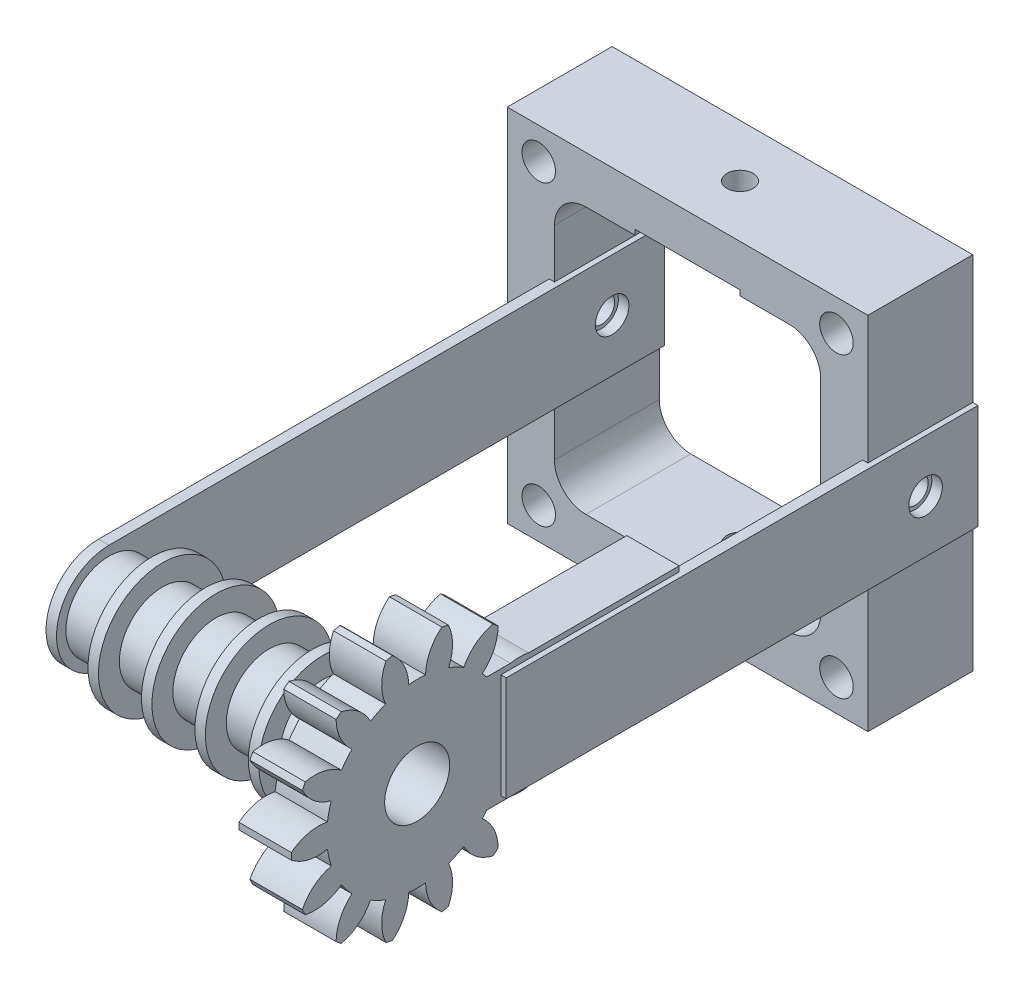
from build123d import *
from build123d.topology import SkipClean

# Parameters (mm, degrees)
BASPROSKE_W              = 5
BASPROSKE_H              = 12
TOOTHCUT_DEPTH           = 18.691806013
TEETHCUTS_COUNT          = 14
TEETHCUTS_ANGLE          = 334.285714286
BORSKE_R                 = 3.1
BORE_DEPTH               = 50.0000508
SKETCH_2_W               = 20
SKETCH_2_H               = 11
EXTRUDE_1_DEPTH          = 5
SKETCH_3_W               = 17
SKETCH_3_H               = 10
CUT_EXTRUDE_1_DEPTH      = 0.5
SKETCH_5_W               = 10
SKETCH_5_H               = 10
SKETCH_5_W_2             = 8
SKETCH_5_H_2             = 8
EXTRUDE_2_DEPTH          = 40
SKETCH_12_W              = 9
SKETCH_12_H              = 10
CUT_EXTRUDE_4_DEPTH      = 63.83857643
CUT_EXTRUDE_2_DEPTH      = 50.726116758
CUT_EXTRUDE_2_DEPTH_BACK = 50.726116758
SKETCH_4_R               = 1.25
SKETCH_7_R               = 4.1
SKETCH_7_R_2             = 3.1
EXTRUDE_3_DEPTH          = 4
PATTERN_LINEAR_1_COUNT   = 5
PATTERN_LINEAR_1_PITCH   = 5.1
SKETCH_14_R              = 3.1
EXTRUDE_5_DEPTH          = 1
SKETCH_15_W              = 34.4
SKETCH_15_H              = 34.4
SKETCH_15_R              = 1.6
EXTRUDE_6_DEPTH          = 5
SKETCH_17_R              = 6.1
SKETCH_17_R_2            = 3.1
EXTRUDE_8_DEPTH          = 1
PATTERN_LINEAR_3_COUNT   = 4
PATTERN_LINEAR_3_PITCH   = 5.1
PATTERN_LINEAR_2_COUNT   = 2
PATTERN_LINEAR_2_PITCH   = 100
MOVE_BODY_2_ANGLE        = 180
MOVE_BODY_2_2_ANGLE      = 180
MOVE_BODY_2_3_ANGLE      = 180
MOVE_BODY_2_4_ANGLE      = 180
MOVE_BODY_2_5_ANGLE      = 180
MOVE_BODY_2_6_ANGLE      = 180
MOVE_BODY_2_7_ANGLE      = 180
MOVE_BODY_2_8_ANGLE      = 180
MOVE_BODY_2_9_ANGLE      = 180
MOVE_BODY_2_10_ANGLE     = 180
MOVE_BODY_2_11_ANGLE     = 180
MOVE_BODY_2_12_ANGLE     = 180
MOVE_BODY_2_13_ANGLE     = 180
CUT_EXTRUDE_5_DEPTH      = 70.120546873
CUT_EXTRUDE_5_DEPTH_BACK = 70.120546873
SKETCH_16_W              = 10
SKETCH_16_H              = 1
SKETCH_16_W_2            = 1
SKETCH_16_H_2            = 10
EXTRUDE_START            = -5
EXTRUDE_7_OUTLINE_W      = 1
EXTRUDE_7_OUTLINE_H      = 10
EXTRUDE_7_DEPTH          = 5
EXTRUDE_7_2_OUTLINE_W    = 1
EXTRUDE_7_2_OUTLINE_H    = 10
EXTRUDE_7_2_DEPTH        = 5
EXTRUDE_7_3_OUTLINE_W    = 10
EXTRUDE_7_3_OUTLINE_H    = 1
EXTRUDE_7_3_DEPTH        = 5
EXTRUDE_7_4_OUTLINE_W    = 10
EXTRUDE_7_4_OUTLINE_H    = 1
EXTRUDE_7_4_DEPTH        = 5
SKETCH_21_R              = 1.25
CUT_EXTRUDE_6_DEPTH      = 115.870796985
SKETCH_22_R              = 1.25
CUT_EXTRUDE_7_DEPTH      = 118.244914602
SKETCH_23_R              = 1.6
CUT_EXTRUDE_8_DEPTH      = 115.870796985
SKETCH_24_R              = 1.6
CUT_EXTRUDE_9_DEPTH      = 118.244914602


with BuildPart() as part:
    # BasProSke → Base-Revolve (revolve)
    with BuildSketch(Plane(origin=(0, 0, 0), x_dir=(1, 0, 0), z_dir=(0, 1, 0)), mode=Mode.PRIVATE) as base_revolve_sk:
        with Locations((2.5, 6)):
            Rectangle(BASPROSKE_W, BASPROSKE_H)
    revolve(base_revolve_sk.sketch.rotate(Axis((-10, 0, 0), (1, 0, 0)), 180), axis=Axis((-10, 0, 0), (1, 0, 0)))

    # TooCutSke → ToothCut (cut, through all)
    with BuildSketch(Plane(origin=(0, 0, 0), x_dir=(0, 0, -1), z_dir=(1, 0, 0))):
        with BuildLine():
            ThreePointArc((0.804845511, 8.586361261), (0, 8.624), (-0.804845511, 8.586361261))
            ThreePointArc((-0.804845511, 8.586361261), (-1.237812142, 10.362618414), (-2.384428228, 11.78663426))
            ThreePointArc((-2.384428228, 11.78663426), (0, 12.0254), (2.384428228, 11.78663426))
            ThreePointArc((2.384428228, 11.78663426), (1.237812142, 10.362618414), (0.804845511, 8.586361261))
        make_face()
    toothcut = extrude(amount=TOOTHCUT_DEPTH, mode=Mode.SUBTRACT)

    # TeethCuts: ToothCut ×14 about axis
    teethcuts_axis = Axis((-10, 0, 0), (1, 0, 0))
    for i in range(1, TEETHCUTS_COUNT):
        add(toothcut.rotate(teethcuts_axis, i * TEETHCUTS_ANGLE / (TEETHCUTS_COUNT - 1)), mode=Mode.SUBTRACT)

    # BorSke → Bore (cut, symmetric)
    with BuildSketch(Plane(origin=(0, 0, 0), x_dir=(0, 0, -1), z_dir=(1, 0, 0))):
        with Locations(Location((0, 0, 0), (0, 0, 180))):
            Circle(BORSKE_R)
    extrude(amount=BORE_DEPTH, both=True, mode=Mode.SUBTRACT)

    # ｽｹｯﾁ2 → ﾎﾞｽ - 押し出し1 (add)
    with BuildSketch(Plane(origin=(5, 0, 0), x_dir=(0, 0, -1), z_dir=(1, 0, 0))):
        with Locations((15, 0)):
            Rectangle(SKETCH_2_W, SKETCH_2_H)
    extrude(amount=-EXTRUDE_1_DEPTH)

    # ｽｹｯﾁ3 → ｶｯﾄ - 押し出し1 (cut)
    with BuildSketch(Plane(origin=(5, 0, 0), x_dir=(0, 0, -1), z_dir=(1, 0, 0))):
        with Locations((16.5, 0)):
            Rectangle(SKETCH_3_W, SKETCH_3_H)
    extrude(amount=-CUT_EXTRUDE_1_DEPTH, mode=Mode.SUBTRACT)

    # ｽｹｯﾁ4 → ｶｯﾄ - 押し出し2 (cut, two sides: drawn at the far end of the back side and taken through both)
    with BuildSketch(Plane.ZY.offset(-CUT_EXTRUDE_2_DEPTH_BACK)):
        with Locations(Location((-21, 0, 0), (0, 0, 180))):
            Circle(SKETCH_4_R)
        with Locations(Location((-13, 0, 0), (0, 0, 180))):
            Circle(SKETCH_4_R)
    extrude(amount=CUT_EXTRUDE_2_DEPTH + CUT_EXTRUDE_2_DEPTH_BACK, mode=Mode.SUBTRACT)


with BuildPart() as body_2:
    # ｽｹｯﾁ5 → ﾎﾞｽ - 押し出し2 (new body)
    with BuildSketch(Plane(origin=(0, 0, -8), x_dir=(-1, 0, 0), z_dir=(0, 0, -1))):
        with Locations((-9.5, 0)):
            Rectangle(SKETCH_5_W, SKETCH_5_H)
        with Locations((-9.5, 0)):
            Rectangle(SKETCH_5_W_2, SKETCH_5_H_2, mode=Mode.SUBTRACT)
    extrude(amount=EXTRUDE_2_DEPTH)

    # ｽｹｯﾁ12 → ｶｯﾄ - 押し出し4 (cut, through all)
    with BuildSketch(Plane(origin=(0, 0, -48), x_dir=(-1, 0, 0), z_dir=(0, 0, -1))):
        with Locations((-10, 0)):
            Rectangle(SKETCH_12_W, SKETCH_12_H)
    extrude(amount=-CUT_EXTRUDE_4_DEPTH, mode=Mode.SUBTRACT)


with BuildPart() as body_3:
    # ｽｹｯﾁ7 → ﾎﾞｽ - 押し出し3 (new body)
    with BuildSketch(Plane.ZY):
        Circle(SKETCH_7_R)
        Circle(SKETCH_7_R_2, mode=Mode.SUBTRACT)
    extrude(amount=EXTRUDE_3_DEPTH)


with BuildPart() as pattern_linear_1_1:
    # 直線ﾊﾟﾀｰﾝ1: pattern copy
    add(body_3.part.moved(Location(Vector(-1, 0, 0) * (1 * PATTERN_LINEAR_1_PITCH))))


with BuildPart() as pattern_linear_1_2:
    # 直線ﾊﾟﾀｰﾝ1: pattern copy
    add(body_3.part.moved(Location(Vector(-1, 0, 0) * (2 * PATTERN_LINEAR_1_PITCH))))


with BuildPart() as pattern_linear_1_3:
    # 直線ﾊﾟﾀｰﾝ1: pattern copy
    add(body_3.part.moved(Location(Vector(-1, 0, 0) * (3 * PATTERN_LINEAR_1_PITCH))))


with BuildPart() as pattern_linear_1_4:
    # 直線ﾊﾟﾀｰﾝ1: pattern copy
    add(body_3.part.moved(Location(Vector(-1, 0, 0) * (4 * PATTERN_LINEAR_1_PITCH))))


with BuildPart() as body_8:
    # ｽｹｯﾁ14 → ﾎﾞｽ - 押し出し5 (new body)
    with BuildSketch(Plane.ZY.offset(24.4)):
        with BuildLine():
            Line((-48, 5), (0, 5))
            ThreePointArc((0, 5), (5, 0), (0, -5))
            Line((0, -5), (-48, -5))
            Line((-48, -5), (-48, 5))
        make_face()
        Circle(SKETCH_14_R, mode=Mode.SUBTRACT)
    extrude(amount=EXTRUDE_5_DEPTH)


with BuildPart() as body_9:
    # ｽｹｯﾁ15 → ﾎﾞｽ - 押し出し6 (new body)
    with BuildSketch(Plane(origin=(0, 0, -48), x_dir=(-1, 0, 0), z_dir=(0, 0, -1))):
        with Locations((12.2, 0)):
            Rectangle(SKETCH_15_W, SKETCH_15_H)
        with Locations(Location((26.4, 14.2, 0), (0, 0, 90))):
            Circle(SKETCH_15_R, mode=Mode.SUBTRACT)
        with Locations(Location((26.4, -14.2, 0), (0, 0, 90))):
            Circle(SKETCH_15_R, mode=Mode.SUBTRACT)
        with Locations(Location((-2, -14.2, 0), (0, 0, 90))):
            Circle(SKETCH_15_R, mode=Mode.SUBTRACT)
        with Locations(Location((-2, 14.2, 0), (0, 0, 90))):
            Circle(SKETCH_15_R, mode=Mode.SUBTRACT)
        with BuildLine():
            Line((21.9, -12.7), (2.5, -12.7))
            ThreePointArc((2.5, -12.7), (0.378679656, -11.821320344), (-0.5, -9.7))
            Line((-0.5, -9.7), (-0.5, 9.7))
            ThreePointArc((-0.5, 9.7), (0.378679656, 11.821320344), (2.5, 12.7))
            Line((2.5, 12.7), (21.9, 12.7))
            ThreePointArc((21.9, 12.7), (24.021320344, 11.821320344), (24.9, 9.7))
            Line((24.9, 9.7), (24.9, -9.7))
            ThreePointArc((24.9, -9.7), (24.021320344, -11.821320344), (21.9, -12.7))
        make_face(mode=Mode.SUBTRACT)
    extrude(amount=-EXTRUDE_6_DEPTH)


with BuildPart() as body_10:
    # ｽｹｯﾁ17 → ﾎﾞｽ - 押し出し8 (new body)
    with BuildSketch(Plane.ZY.offset(4)):
        Circle(SKETCH_17_R)
        Circle(SKETCH_17_R_2, mode=Mode.SUBTRACT)
    extrude(amount=EXTRUDE_8_DEPTH)


with BuildPart() as pattern_linear_3_1:
    # 直線ﾊﾟﾀｰﾝ3: pattern copy
    add(body_10.part.moved(Location(Vector(-1, 0, 0) * (1 * PATTERN_LINEAR_3_PITCH))))


with BuildPart() as pattern_linear_3_2:
    # 直線ﾊﾟﾀｰﾝ3: pattern copy
    add(body_10.part.moved(Location(Vector(-1, 0, 0) * (2 * PATTERN_LINEAR_3_PITCH))))


with BuildPart() as pattern_linear_3_3:
    # 直線ﾊﾟﾀｰﾝ3: pattern copy
    add(body_10.part.moved(Location(Vector(-1, 0, 0) * (3 * PATTERN_LINEAR_3_PITCH))))


with BuildPart() as pattern_linear_2_1:
    # 直線ﾊﾟﾀｰﾝ2: pattern copy
    add(body_10.part.moved(Location(Vector(0, 0, -1) * (1 * PATTERN_LINEAR_2_PITCH))))


with BuildPart() as pattern_linear_2_2:
    # 直線ﾊﾟﾀｰﾝ2: pattern copy
    add(pattern_linear_3_1.part.moved(Location(Vector(0, 0, -1) * (1 * PATTERN_LINEAR_2_PITCH))))


with BuildPart() as pattern_linear_2_3:
    # 直線ﾊﾟﾀｰﾝ2: pattern copy
    add(pattern_linear_3_2.part.moved(Location(Vector(0, 0, -1) * (1 * PATTERN_LINEAR_2_PITCH))))


with BuildPart() as pattern_linear_2_4:
    # 直線ﾊﾟﾀｰﾝ2: pattern copy
    add(pattern_linear_3_3.part.moved(Location(Vector(0, 0, -1) * (1 * PATTERN_LINEAR_2_PITCH))))


with BuildPart() as pattern_linear_2_5:
    # 直線ﾊﾟﾀｰﾝ2: pattern copy
    add(body_3.part.moved(Location(Vector(0, 0, -1) * (1 * PATTERN_LINEAR_2_PITCH))))


with BuildPart() as pattern_linear_2_6:
    # 直線ﾊﾟﾀｰﾝ2: pattern copy
    add(pattern_linear_1_1.part.moved(Location(Vector(0, 0, -1) * (1 * PATTERN_LINEAR_2_PITCH))))


with BuildPart() as pattern_linear_2_7:
    # 直線ﾊﾟﾀｰﾝ2: pattern copy
    add(body_9.part.moved(Location(Vector(0, 0, -1) * (1 * PATTERN_LINEAR_2_PITCH))))


with BuildPart() as pattern_linear_2_8:
    # 直線ﾊﾟﾀｰﾝ2: pattern copy
    add(pattern_linear_1_2.part.moved(Location(Vector(0, 0, -1) * (1 * PATTERN_LINEAR_2_PITCH))))


with BuildPart() as pattern_linear_2_9:
    # 直線ﾊﾟﾀｰﾝ2: pattern copy
    add(pattern_linear_1_3.part.moved(Location(Vector(0, 0, -1) * (1 * PATTERN_LINEAR_2_PITCH))))


with BuildPart() as pattern_linear_2_10:
    # 直線ﾊﾟﾀｰﾝ2: pattern copy
    add(body_2.part.moved(Location(Vector(0, 0, -1) * (1 * PATTERN_LINEAR_2_PITCH))))


with BuildPart() as pattern_linear_2_11:
    # 直線ﾊﾟﾀｰﾝ2: pattern copy
    add(part.part.moved(Location(Vector(0, 0, -1) * (1 * PATTERN_LINEAR_2_PITCH))))


with BuildPart() as pattern_linear_2_12:
    # 直線ﾊﾟﾀｰﾝ2: pattern copy
    add(pattern_linear_1_4.part.moved(Location(Vector(0, 0, -1) * (1 * PATTERN_LINEAR_2_PITCH))))


with BuildPart() as pattern_linear_2_13:
    # 直線ﾊﾟﾀｰﾝ2: pattern copy
    add(body_8.part.moved(Location(Vector(0, 0, -1) * (1 * PATTERN_LINEAR_2_PITCH))))


with BuildPart() as pattern_linear_2_2_1:
    # Move Body 2: read off the stored shape, not the designer's step
    # Move Body 2: moved
    add(pattern_linear_2_2.part.moved(Location((12.2, 12.2, 196))).rotate(Axis((0, 0, 0), (0.7071067812, -0.7071067812, 0)), MOVE_BODY_2_ANGLE))


with BuildPart() as pattern_linear_2_12_1:
    # Move Body 2 2: moved
    add(pattern_linear_2_12.part.moved(Location((12.2, 12.2, 196))).rotate(Axis((0, 0, 0), (0.7071067812, -0.7071067812, 0)), MOVE_BODY_2_2_ANGLE))


with BuildPart() as pattern_linear_2_9_1:
    # Move Body 2 3: moved
    add(pattern_linear_2_9.part.moved(Location((12.2, 12.2, 196))).rotate(Axis((0, 0, 0), (0.7071067812, -0.7071067812, 0)), MOVE_BODY_2_3_ANGLE))


with BuildPart() as pattern_linear_2_11_1:
    # Move Body 2 4: moved
    add(pattern_linear_2_11.part.moved(Location((12.2, 12.2, 196))).rotate(Axis((0, 0, 0), (0.7071067812, -0.7071067812, 0)), MOVE_BODY_2_4_ANGLE))


with BuildPart() as pattern_linear_2_3_1:
    # Move Body 2 5: moved
    add(pattern_linear_2_3.part.moved(Location((12.2, 12.2, 196))).rotate(Axis((0, 0, 0), (0.7071067812, -0.7071067812, 0)), MOVE_BODY_2_5_ANGLE))


with BuildPart() as pattern_linear_2_4_1:
    # Move Body 2 6: moved
    add(pattern_linear_2_4.part.moved(Location((12.2, 12.2, 196))).rotate(Axis((0, 0, 0), (0.7071067812, -0.7071067812, 0)), MOVE_BODY_2_6_ANGLE))


with BuildPart() as pattern_linear_2_5_1:
    # Move Body 2 7: moved
    add(pattern_linear_2_5.part.moved(Location((12.2, 12.2, 196))).rotate(Axis((0, 0, 0), (0.7071067812, -0.7071067812, 0)), MOVE_BODY_2_7_ANGLE))


with BuildPart() as pattern_linear_2_8_1:
    # Move Body 2 8: moved
    add(pattern_linear_2_8.part.moved(Location((12.2, 12.2, 196))).rotate(Axis((0, 0, 0), (0.7071067812, -0.7071067812, 0)), MOVE_BODY_2_8_ANGLE))


with BuildPart() as pattern_linear_2_6_1:
    # Move Body 2 9: moved
    add(pattern_linear_2_6.part.moved(Location((12.2, 12.2, 196))).rotate(Axis((0, 0, 0), (0.7071067812, -0.7071067812, 0)), MOVE_BODY_2_9_ANGLE))


with BuildPart() as pattern_linear_2_1_1:
    # Move Body 2 10: moved
    add(pattern_linear_2_1.part.moved(Location((12.2, 12.2, 196))).rotate(Axis((0, 0, 0), (0.7071067812, -0.7071067812, 0)), MOVE_BODY_2_10_ANGLE))


with BuildPart() as pattern_linear_2_13_1:
    # Move Body 2 11: moved
    add(pattern_linear_2_13.part.moved(Location((12.2, 12.2, 196))).rotate(Axis((0, 0, 0), (0.7071067812, -0.7071067812, 0)), MOVE_BODY_2_11_ANGLE))

    # Extrude 7 3 outline → Extrude 7 3 (add)
    with BuildSketch(Plane.XY.offset(-48)):
        with Locations((-12.2, 12.7)):
            Rectangle(EXTRUDE_7_3_OUTLINE_W, EXTRUDE_7_3_OUTLINE_H)
    extrude(amount=EXTRUDE_7_3_DEPTH)


with BuildPart() as pattern_linear_2_10_1:
    # Move Body 2 12: moved
    add(pattern_linear_2_10.part.moved(Location((12.2, 12.2, 196))).rotate(Axis((0, 0, 0), (0.7071067812, -0.7071067812, 0)), MOVE_BODY_2_12_ANGLE))

    # Extrude 7 4 outline → Extrude 7 4 (add)
    with BuildSketch(Plane.XY.offset(-48)):
        with Locations((-12.2, -17.2)):
            Rectangle(EXTRUDE_7_4_OUTLINE_W, EXTRUDE_7_4_OUTLINE_H)
    extrude(amount=EXTRUDE_7_4_DEPTH)


with BuildPart() as pattern_linear_2_7_1:
    # Move Body 2 13: moved
    add(pattern_linear_2_7.part.moved(Location((12.2, 12.2, 196))).rotate(Axis((0, 0, 0), (0.7071067812, -0.7071067812, 0)), MOVE_BODY_2_13_ANGLE))


with BuildPart() as cut_extrude_5_tool:
    # ｽｹｯﾁ16 → ｶｯﾄ - 押し出し5 (new, two sides: drawn at the far end of the back side and taken through both)
    with BuildSketch(Plane.XY.offset(-48).offset(-CUT_EXTRUDE_5_DEPTH_BACK)):
        with Locations((-12.2, -17.2)):
            Rectangle(SKETCH_16_W, SKETCH_16_H)
        with Locations((5, 0)):
            Rectangle(SKETCH_16_W_2, SKETCH_16_H_2)
        with Locations((-12.2, 12.7)):
            Rectangle(SKETCH_16_W, SKETCH_16_H)
        with Locations((-24.9, 0)):
            Rectangle(SKETCH_16_W_2, SKETCH_16_H_2)
    extrude(amount=CUT_EXTRUDE_5_DEPTH + CUT_EXTRUDE_5_DEPTH_BACK)


with BuildPart() as body_9_1:
    add(body_9.part)

    # ｶｯﾄ - 押し出し5: cut by cut_extrude_5_tool
    add(cut_extrude_5_tool.part, mode=Mode.SUBTRACT)


with BuildPart() as pattern_linear_2_7_2:
    add(pattern_linear_2_7_1.part)

    # ｶｯﾄ - 押し出し5: cut by cut_extrude_5_tool
    add(cut_extrude_5_tool.part, mode=Mode.SUBTRACT)


with BuildPart() as body_9_2:
    add(body_9_1.part)

    # Combine 1: union 直線ﾊﾟﾀｰﾝ2_7
    add(pattern_linear_2_7_2.part)

    # ｽｹｯﾁ21 → ｶｯﾄ - 押し出し6 (cut, through all)
    with SkipClean():  # the faces are left unmerged after this step: merging them gives an invalid solid
        with BuildSketch(Plane.ZY.offset(29.4)):
            with Locations((-48, 0)):
                Circle(SKETCH_21_R)
        extrude(amount=-CUT_EXTRUDE_6_DEPTH, mode=Mode.SUBTRACT)

    # ｽｹｯﾁ22 → ｶｯﾄ - 押し出し7 (cut, through all)
    with SkipClean():  # the faces are left unmerged after this step: merging them gives an invalid solid
        with BuildSketch(Plane.XZ.offset(17.7)):
            with Locations(Location((-12.2, -48, 0), (0, 0, 270))):
                Circle(SKETCH_22_R)
        extrude(amount=-CUT_EXTRUDE_7_DEPTH, mode=Mode.SUBTRACT)


with BuildPart() as body_8_1:
    add(body_8.part)

    # ﾎﾞｽ - 押し出し7: read off the stored shape, not the designer's step
    # ﾎﾞｽ - 押し出し7 outline → ﾎﾞｽ - 押し出し7 (add)
    with BuildSketch(Plane.XY.offset(-48).offset(EXTRUDE_START)):
        with Locations((-24.9, 0)):
            Rectangle(EXTRUDE_7_OUTLINE_W, EXTRUDE_7_OUTLINE_H)
    extrude(amount=EXTRUDE_7_DEPTH)


with BuildPart() as body_2_1:
    add(body_2.part)

    # Extrude 7 2 outline → Extrude 7 2 (add)
    with BuildSketch(Plane.XY.offset(-48).offset(EXTRUDE_START)):
        with Locations((5, 0)):
            Rectangle(EXTRUDE_7_2_OUTLINE_W, EXTRUDE_7_2_OUTLINE_H)
    extrude(amount=EXTRUDE_7_2_DEPTH)


with BuildPart() as cut_extrude_8_tool:
    # ｽｹｯﾁ23 → ｶｯﾄ - 押し出し8 (new, through all)
    with BuildSketch(Plane.ZY.offset(29.4)):
        with Locations(Location((-48, 0, 0), (0, 0, 180))):
            Circle(SKETCH_23_R)
    extrude(amount=-CUT_EXTRUDE_8_DEPTH)


with BuildPart() as body_2_2:
    add(body_2_1.part)

    # ｶｯﾄ - 押し出し8: cut by cut_extrude_8_tool
    add(cut_extrude_8_tool.part, mode=Mode.SUBTRACT)


with BuildPart() as body_8_2:
    add(body_8_1.part)

    # ｶｯﾄ - 押し出し8: cut by cut_extrude_8_tool
    add(cut_extrude_8_tool.part, mode=Mode.SUBTRACT)


with BuildPart() as cut_extrude_9_tool:
    # ｽｹｯﾁ24 → ｶｯﾄ - 押し出し9 (new, through all)
    with BuildSketch(Plane(origin=(0, 17.2, 0), x_dir=(1, 0, 0), z_dir=(0, 1, 0))):
        with Locations((-12.2, 48)):
            Circle(SKETCH_24_R)
    extrude(amount=-CUT_EXTRUDE_9_DEPTH)


with BuildPart() as pattern_linear_2_13_2:
    add(pattern_linear_2_13_1.part)

    # ｶｯﾄ - 押し出し9: cut by cut_extrude_9_tool
    add(cut_extrude_9_tool.part, mode=Mode.SUBTRACT)


with BuildPart() as pattern_linear_2_10_2:
    add(pattern_linear_2_10_1.part)

    # ｶｯﾄ - 押し出し9: cut by cut_extrude_9_tool
    add(cut_extrude_9_tool.part, mode=Mode.SUBTRACT)


solid = Compound([part.part, body_3.part, pattern_linear_1_1.part, pattern_linear_1_2.part, pattern_linear_1_3.part, pattern_linear_1_4.part, body_10.part, pattern_linear_3_1.part, pattern_linear_3_2.part, pattern_linear_3_3.part, body_9_2.part, body_2_2.part, body_8_2.part])
